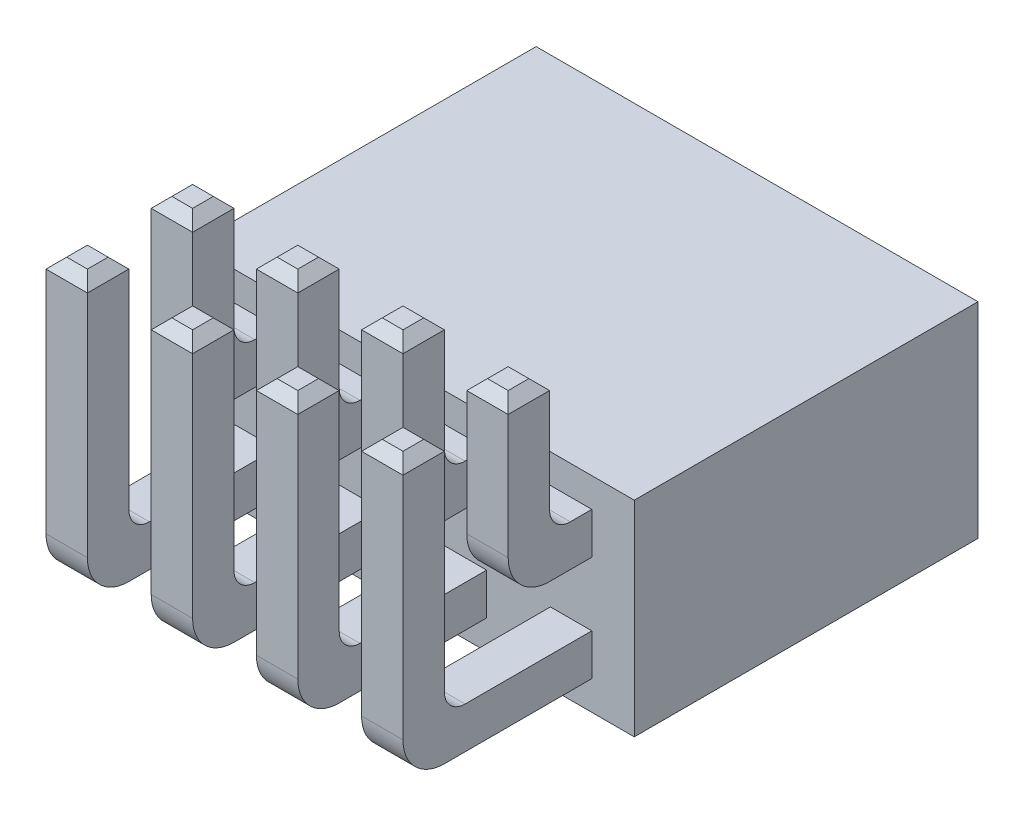
from build123d import *

# Parameters (mm, degrees)
SKETCH1_W           = 10.67
SKETCH1_H           = 4.95
BOSS_EXTRUDE1_DEPTH = 8.3
SKETCH3_W           = 1.382324252
SKETCH3_H           = 1.382324252
CUT_EXTRUDE1_DEPTH  = 3
BOSS_EXTRUDE2_START = 3.31
BOSS_EXTRUDE2_DEPTH = 1
LPATTERN1_COUNT     = 4
LPATTERN1_PITCH     = 2.54
CHAMFER1_SIZE       = 0.25


with BuildPart() as part:
    # Sketch1 → Boss-Extrude1 (new body)
    with BuildSketch(Plane.XY):
        Rectangle(SKETCH1_W, SKETCH1_H)
    extrude(amount=BOSS_EXTRUDE1_DEPTH)

    # Sketch3 → Cut-Extrude1 (cut)
    with BuildSketch(Plane(origin=(0, 0, 0), x_dir=(-1, 0, 0), z_dir=(0, 0, -1))):
        with Locations((-1.27, 1.27)):
            Rectangle(SKETCH3_W, SKETCH3_H)
        with Locations((-3.81, 1.27)):
            Rectangle(SKETCH3_W, SKETCH3_H)
        with Locations((1.27, 1.27)):
            Rectangle(SKETCH3_W, SKETCH3_H)
        with Locations((3.81, 1.27)):
            Rectangle(SKETCH3_W, SKETCH3_H)
        with Locations((-1.27, -1.27)):
            Rectangle(SKETCH3_W, SKETCH3_H)
        with Locations((1.27, -1.27)):
            Rectangle(SKETCH3_W, SKETCH3_H)
        with Locations((3.81, -1.27)):
            Rectangle(SKETCH3_W, SKETCH3_H)
        with Locations((-3.81, -1.27)):
            Rectangle(SKETCH3_W, SKETCH3_H)
    extrude(amount=-CUT_EXTRUDE1_DEPTH, mode=Mode.SUBTRACT)

    # Sketch4 → Boss-Extrude2 (add)
    with BuildSketch(Plane(origin=(0, 0, 0), x_dir=(0, 0, -1), z_dir=(1, 0, 0)).offset(BOSS_EXTRUDE2_START)):
        with BuildLine():
            Line((-8.3, 0.77), (-9.32, 0.77))
            ThreePointArc((-9.32, 0.77), (-10.027106781, 1.062893219), (-10.32, 1.77))
            Line((-10.32, 1.77), (-10.32, 5.015))
            Line((-10.32, 5.015), (-9.32, 5.015))
            Line((-9.32, 5.015), (-9.32, 2.27))
            ThreePointArc((-9.32, 2.27), (-9.173553391, 1.916446609), (-8.82, 1.77))
            Line((-8.82, 1.77), (-8.3, 1.77))
            Line((-8.3, 1.77), (-8.3, 0.77))
        make_face()
        with BuildLine():
            Line((-8.3, -1.77), (-11.86, -1.77))
            ThreePointArc((-11.86, -1.77), (-12.567106781, -1.477106781), (-12.86, -0.77))
            Line((-12.86, -0.77), (-12.86, 5.015))
            Line((-12.86, 5.015), (-11.86, 5.015))
            Line((-11.86, 5.015), (-11.86, -0.27))
            ThreePointArc((-11.86, -0.27), (-11.713553391, -0.623553391), (-11.36, -0.77))
            Line((-11.36, -0.77), (-8.3, -0.77))
            Line((-8.3, -0.77), (-8.3, -1.77))
        make_face()
    boss_extrude2 = extrude(amount=BOSS_EXTRUDE2_DEPTH)

    # LPattern1: Boss-Extrude2 ×4
    with Locations(*[(-i * LPATTERN1_PITCH, 0, 0) for i in range(1, LPATTERN1_COUNT)]):
        add(boss_extrude2)

    # Chamfer1
    chamfer1_edges = [part.edges().sort_by_distance(p)[0] for p in [
        (-3.81, 5.015, 11.86),
        (-3.31, 5.015, 12.36),
        (-3.81, 5.015, 12.86),
        (-4.31, 5.015, 12.36),
        (-1.27, 5.015, 11.86),
        (-0.77, 5.015, 12.36),
        (-1.27, 5.015, 12.86),
        (-1.77, 5.015, 12.36),
        (1.27, 5.015, 11.86),
        (1.77, 5.015, 12.36),
        (1.27, 5.015, 12.86),
        (0.77, 5.015, 12.36),
        (3.81, 5.015, 11.86),
        (4.31, 5.015, 12.36),
        (3.81, 5.015, 12.86),
        (3.31, 5.015, 12.36),
        (3.81, 5.015, 9.32),
        (4.31, 5.015, 9.82),
        (3.81, 5.015, 10.32),
        (3.31, 5.015, 9.82),
        (1.27, 5.015, 9.32),
        (1.77, 5.015, 9.82),
        (1.27, 5.015, 10.32),
        (0.77, 5.015, 9.82),
        (-1.27, 5.015, 9.32),
        (-0.77, 5.015, 9.82),
        (-1.27, 5.015, 10.32),
        (-1.77, 5.015, 9.82),
        (-3.81, 5.015, 9.32),
        (-3.31, 5.015, 9.82),
        (-3.81, 5.015, 10.32),
        (-4.31, 5.015, 9.82),
    ]]
    chamfer(chamfer1_edges, length=CHAMFER1_SIZE)


solid = part.part
